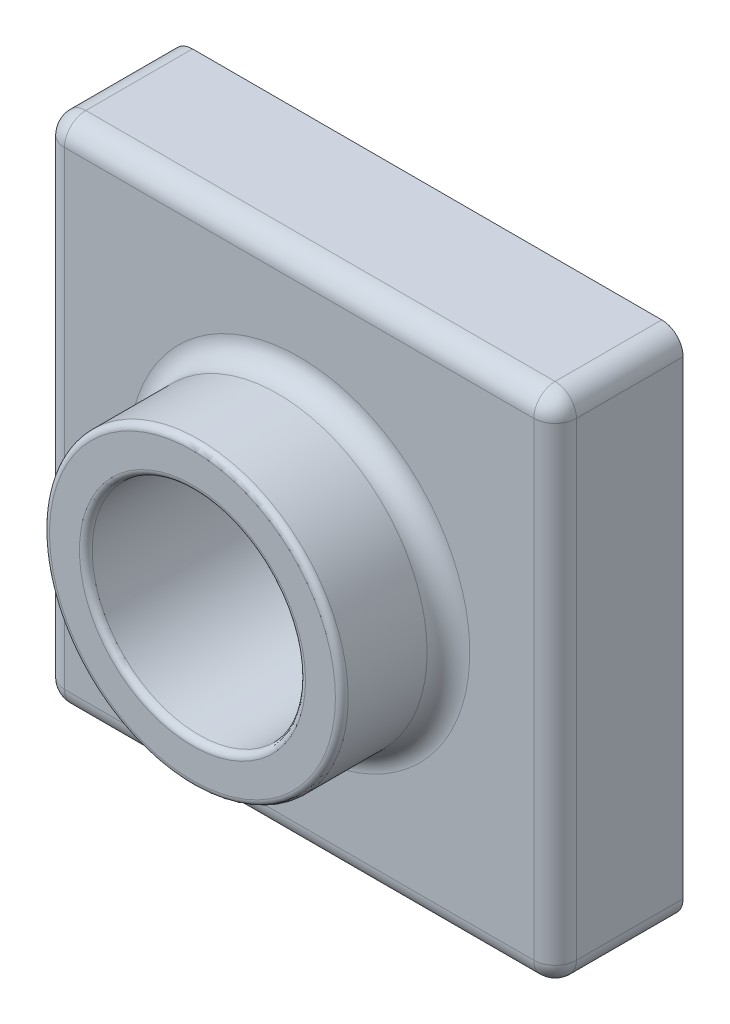
from build123d import *

# Parameters (mm, degrees)
ESQUISSE2_W             = 120
ESQUISSE2_H             = 120
BOSS_EXTRU_1_DEPTH      = 30
ESQUISSE3_R             = 35
BOSS_EXTRU_3_DEPTH      = 25
ESQUISSE9_R             = 25
ENL_V_MAT_EXTRU_1_DEPTH = 179.395627749
CONG_1_R                = 5
CONG_2_R                = 1.5
COQUE1_T                = -2


with BuildPart() as part:
    # Esquisse2 → Boss.-Extru.1 (new body)
    with BuildSketch(Plane.XY):
        with Locations((60, 60)):
            Rectangle(ESQUISSE2_W, ESQUISSE2_H)
    extrude(amount=BOSS_EXTRU_1_DEPTH)

    # Esquisse3 → Boss.-Extru.3 (add)
    with BuildSketch(Plane.XY.offset(30)):
        with Locations((60, 60)):
            Circle(ESQUISSE3_R)
    extrude(amount=BOSS_EXTRU_3_DEPTH)

    # Esquisse9 → Enlèv. mat.-Extru.1 (cut, through all)
    with BuildSketch(Plane.XY.offset(55)):
        with Locations((60, 60)):
            Circle(ESQUISSE9_R)
    extrude(amount=-ENL_V_MAT_EXTRU_1_DEPTH, mode=Mode.SUBTRACT)

    # Congé1
    cong_1_edges = [part.edges().sort_by_distance(p)[0] for p in [
        (0, 0, 15),
        (0, 120, 15),
        (0, 60, 30),
        (60, 0, 30),
        (120, 0, 15),
        (120, 60, 30),
        (60, 120, 30),
        (120, 120, 15),
        (25, 60, 30),
    ]]
    fillet(cong_1_edges, radius=CONG_1_R)

    # Congé2
    cong_2_edges = [part.edges().sort_by_distance(p)[0] for p in [
        (35, 60, 55),
        (25, 60, 55),
    ]]
    fillet(cong_2_edges, radius=CONG_2_R)

    # Coque1
    coque1_openings = [part.faces().sort_by_distance(p)[0] for p in [
        (60, 1.697056275, 0),
    ]]
    offset(amount=COQUE1_T, openings=coque1_openings, kind=Kind.INTERSECTION)


solid = part.part
